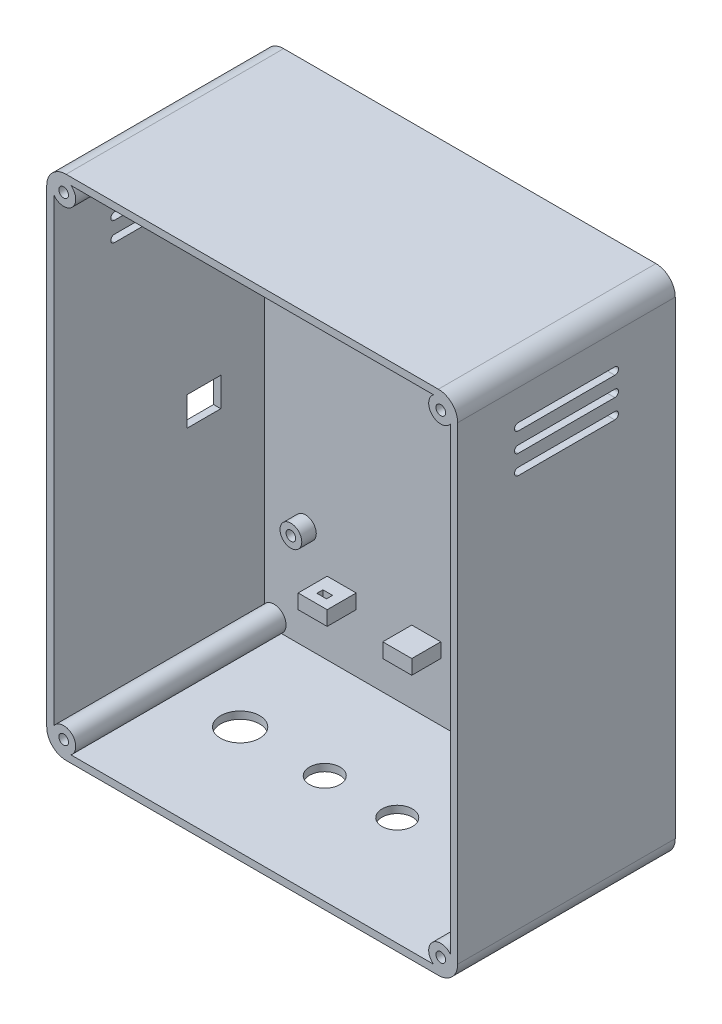
from build123d import *

# Parameters (mm, degrees)
BLOCK_DEPTH                    = 90
SHELL1_T                       = -3
SKETCH2_R                      = 5
CORNER_COLUMNS_DEPTH           = 90
SKETCH3_R                      = 2
FRONT_PANEL_INSERT_HOLES_DEPTH = 7
SKETCH4_R                      = 4.5
PLATE_BOSSES_DEPTH             = 6
SKETCH5_R                      = 2
PLATE_INSERT_HOLES_DEPTH       = 7
SKETCH6_R                      = 8.1
SKETCH6_R_2                    = 6.3
CABLE_GLAND_HOLES_DEPTH        = 4
SKETCH7_W                      = 12
SKETCH7_H                      = 6
CABLE_TIE_BARS_DEPTH           = 12
SKETCH8_W                      = 4
SKETCH8_H                      = 2.5
SKETCH8_H_2                    = 5
CABLE_TIE_SLOTS_DEPTH          = 6.02
SKETCH9_W                      = 14
SKETCH9_H                      = 12
USB_ACCESS_DEPTH               = 4
VENTS_LEFT_DEPTH               = 4
VENTS_START                    = -4
VENTS_RIGHT_DEPTH              = 4
SKETCH12_R                     = 4.75
KEYHOLE_HEADS_DEPTH            = 4
KEYHOLE_SLOTS_DEPTH            = 4


with BuildPart() as part:
    # Sketch1 → Block (new body)
    with BuildSketch(Plane.XY):
        with BuildLine():
            Line((-77, 0), (77, 0))
            ThreePointArc((77, 0), (82.656854249, 2.343145751), (85, 8))
            Line((85, 8), (85, 202))
            ThreePointArc((85, 202), (82.656854249, 207.656854249), (77, 210))
            Line((77, 210), (-77, 210))
            ThreePointArc((-77, 210), (-82.656854249, 207.656854249), (-85, 202))
            Line((-85, 202), (-85, 8))
            ThreePointArc((-85, 8), (-82.656854249, 2.343145751), (-77, 0))
        make_face()
    extrude(amount=BLOCK_DEPTH)

    # Shell1
    shell1_openings = [part.faces().sort_by_distance(p)[0] for p in [
        (0, 105, 90),
    ]]
    offset(amount=SHELL1_T, openings=shell1_openings, kind=Kind.INTERSECTION)

    # Sketch2 → Corner columns (add)
    with BuildSketch(Plane.XY):
        with Locations((-78, 7)):
            Circle(SKETCH2_R)
        with Locations((78, 7)):
            Circle(SKETCH2_R)
        with Locations((-78, 203)):
            Circle(SKETCH2_R)
        with Locations((78, 203)):
            Circle(SKETCH2_R)
    extrude(amount=CORNER_COLUMNS_DEPTH)

    # Sketch3 → Front panel insert holes (cut)
    with BuildSketch(Plane.XY.offset(90)):
        with Locations((-78, 7)):
            Circle(SKETCH3_R)
        with Locations((78, 7)):
            Circle(SKETCH3_R)
        with Locations((-78, 203)):
            Circle(SKETCH3_R)
        with Locations((78, 203)):
            Circle(SKETCH3_R)
    extrude(amount=-FRONT_PANEL_INSERT_HOLES_DEPTH, mode=Mode.SUBTRACT)

    # Sketch4 → Plate bosses (add)
    with BuildSketch(Plane.XY.offset(3)):
        with Locations((-65, 46)):
            Circle(SKETCH4_R)
        with Locations((65, 46)):
            Circle(SKETCH4_R)
        with Locations((-65, 190)):
            Circle(SKETCH4_R)
        with Locations((65, 190)):
            Circle(SKETCH4_R)
    extrude(amount=PLATE_BOSSES_DEPTH)

    # Sketch5 → Plate insert holes (cut)
    with BuildSketch(Plane.XY.offset(9)):
        with Locations((-65, 46)):
            Circle(SKETCH5_R)
        with Locations((65, 46)):
            Circle(SKETCH5_R)
        with Locations((-65, 190)):
            Circle(SKETCH5_R)
        with Locations((65, 190)):
            Circle(SKETCH5_R)
    extrude(amount=-PLATE_INSERT_HOLES_DEPTH, mode=Mode.SUBTRACT)

    # Sketch6 → Cable gland holes (cut)
    with BuildSketch(Plane(origin=(0, 0, 0), x_dir=(1, 0, 0), z_dir=(0, 1, 0))):
        with Locations((-50, -45)):
            Circle(SKETCH6_R)
        with Locations((-15, -45)):
            Circle(SKETCH6_R_2)
        with Locations((15, -45)):
            Circle(SKETCH6_R_2)
        with Locations((50, -45)):
            Circle(SKETCH6_R_2)
    extrude(amount=CABLE_GLAND_HOLES_DEPTH, mode=Mode.SUBTRACT)

    # Sketch7 → Cable tie bars (add)
    with BuildSketch(Plane.XY.offset(3)):
        with Locations((-50, 30)):
            Rectangle(SKETCH7_W, SKETCH7_H)
        with Locations((-15, 30)):
            Rectangle(SKETCH7_W, SKETCH7_H)
        with Locations((15, 30)):
            Rectangle(SKETCH7_W, SKETCH7_H)
        with Locations((50, 30)):
            Rectangle(SKETCH7_W, SKETCH7_H)
    extrude(amount=CABLE_TIE_BARS_DEPTH)

    # Sketch8 → Cable tie slots (cut)
    with BuildSketch(Plane(origin=(0, 26.99, 0), x_dir=(1, 0, 0), z_dir=(0, 1, 0))):
        with Locations((-50, -10)):
            Rectangle(SKETCH8_W, SKETCH8_H)
        with Locations((15, -11.25)):
            Rectangle(SKETCH8_W, SKETCH8_H_2)
        with Locations((50, -11.25)):
            Rectangle(SKETCH8_W, SKETCH8_H_2)
    extrude(amount=CABLE_TIE_SLOTS_DEPTH, mode=Mode.SUBTRACT)

    # Sketch9 → USB access (cut)
    with BuildSketch(Plane(origin=(-85, 0, 0), x_dir=(0, 0, -1), z_dir=(1, 0, 0))):
        with Locations((-28, 95)):
            Rectangle(SKETCH9_W, SKETCH9_H)
    extrude(amount=USB_ACCESS_DEPTH, mode=Mode.SUBTRACT)

    # Sketch10 → Vents left (cut)
    with BuildSketch(Plane(origin=(-85, 0, 0), x_dir=(0, 0, -1), z_dir=(1, 0, 0))):
        with BuildLine():
            Line((-25, 170.5), (-65, 170.5))
            ThreePointArc((-65, 170.5), (-66.5, 172), (-65, 173.5))
            Line((-65, 173.5), (-25, 173.5))
            ThreePointArc((-25, 173.5), (-23.5, 172), (-25, 170.5))
        make_face()
        with BuildLine():
            Line((-25, 178.5), (-65, 178.5))
            ThreePointArc((-65, 178.5), (-66.5, 180), (-65, 181.5))
            Line((-65, 181.5), (-25, 181.5))
            ThreePointArc((-25, 181.5), (-23.5, 180), (-25, 178.5))
        make_face()
        with BuildLine():
            Line((-25, 186.5), (-65, 186.5))
            ThreePointArc((-65, 186.5), (-66.5, 188), (-65, 189.5))
            Line((-65, 189.5), (-25, 189.5))
            ThreePointArc((-25, 189.5), (-23.5, 188), (-25, 186.5))
        make_face()
    extrude(amount=VENTS_LEFT_DEPTH, mode=Mode.SUBTRACT)

    # Sketch11 → Vents right (cut)
    with BuildSketch(Plane(origin=(85, 0, 0), x_dir=(0, 0, -1), z_dir=(1, 0, 0)).offset(VENTS_START)):
        with BuildLine():
            Line((-25, 170.5), (-65, 170.5))
            ThreePointArc((-65, 170.5), (-66.5, 172), (-65, 173.5))
            Line((-65, 173.5), (-25, 173.5))
            ThreePointArc((-25, 173.5), (-23.5, 172), (-25, 170.5))
        make_face()
        with BuildLine():
            Line((-25, 178.5), (-65, 178.5))
            ThreePointArc((-65, 178.5), (-66.5, 180), (-65, 181.5))
            Line((-65, 181.5), (-25, 181.5))
            ThreePointArc((-25, 181.5), (-23.5, 180), (-25, 178.5))
        make_face()
        with BuildLine():
            Line((-25, 186.5), (-65, 186.5))
            ThreePointArc((-65, 186.5), (-66.5, 188), (-65, 189.5))
            Line((-65, 189.5), (-25, 189.5))
            ThreePointArc((-25, 189.5), (-23.5, 188), (-25, 186.5))
        make_face()
    extrude(amount=VENTS_RIGHT_DEPTH, mode=Mode.SUBTRACT)

    # Sketch12 → Keyhole heads (cut)
    with BuildSketch(Plane.XY):
        with Locations((-45, 165)):
            Circle(SKETCH12_R)
        with Locations((45, 165)):
            Circle(SKETCH12_R)
    extrude(amount=KEYHOLE_HEADS_DEPTH, mode=Mode.SUBTRACT)

    # Sketch13 → Keyhole slots (cut)
    with BuildSketch(Plane.XY):
        with BuildLine():
            Line((-47.4, 165), (-47.4, 176))
            ThreePointArc((-47.4, 176), (-45, 178.4), (-42.6, 176))
            Line((-42.6, 176), (-42.6, 165))
            ThreePointArc((-42.6, 165), (-45, 162.6), (-47.4, 165))
        make_face()
        with BuildLine():
            Line((42.6, 165), (42.6, 176))
            ThreePointArc((42.6, 176), (45, 178.4), (47.4, 176))
            Line((47.4, 176), (47.4, 165))
            ThreePointArc((47.4, 165), (45, 162.6), (42.6, 165))
        make_face()
    extrude(amount=KEYHOLE_SLOTS_DEPTH, mode=Mode.SUBTRACT)


solid = part.part
